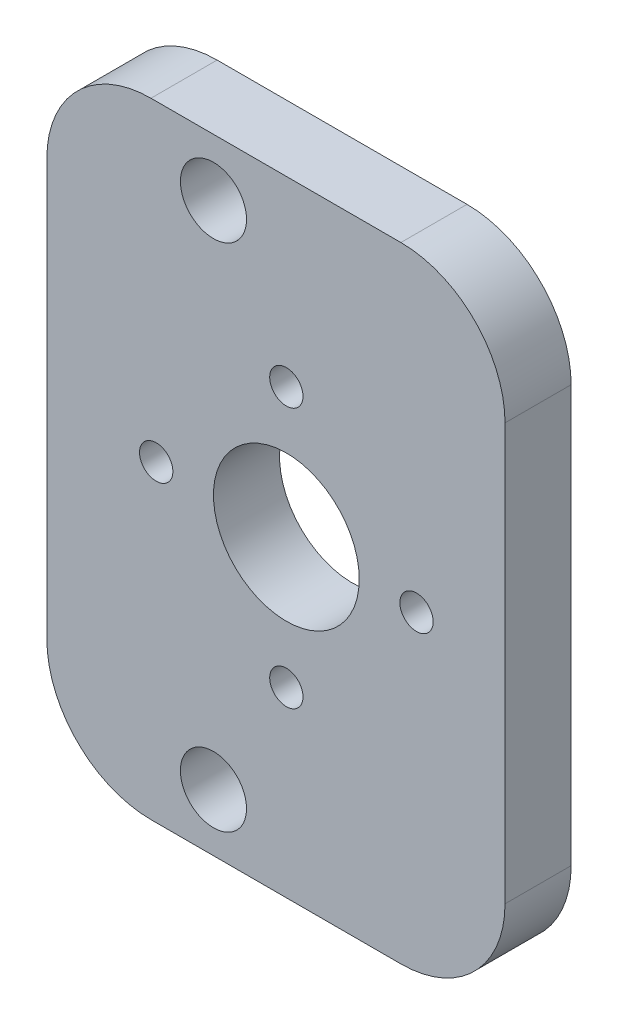
from build123d import *

# Parameters (mm, degrees)
SKETCH2_W            = 44
SKETCH2_H            = 60
SKETCH2_R            = 7
SKETCH2_R_2          = 3.175
BOSS_EXTRUDE1_DEPTH  = 3.175
M3_CLEARANCE_HOLE1_D = 3.2
FILLET1_R            = 10


with BuildPart() as part:
    # Sketch2 → Boss-Extrude1 (new, symmetric)
    with BuildSketch(Plane.XY):
        with Locations((-1, 0)):
            Rectangle(SKETCH2_W, SKETCH2_H)
        Circle(SKETCH2_R, mode=Mode.SUBTRACT)
        with Locations((-7, 24.5)):
            Circle(SKETCH2_R_2, mode=Mode.SUBTRACT)
        with Locations((-7, -24.5)):
            Circle(SKETCH2_R_2, mode=Mode.SUBTRACT)
    extrude(amount=BOSS_EXTRUDE1_DEPTH, both=True)

    # M3 Clearance Hole1 (through all)
    with Locations(Plane.XY.offset(3.175)):
        with Locations((0, 12.5), (12.5, 0), (0, -12.5), (-12.5, 0)):
            Hole(M3_CLEARANCE_HOLE1_D / 2)

    # Fillet1
    fillet1_edges = [part.edges().sort_by_distance(p)[0] for p in [
        (21, -30, 0),
        (21, 30, 0),
        (-23, -30, 0),
        (-23, 30, 0),
    ]]
    fillet(fillet1_edges, radius=FILLET1_R)


solid = part.part
